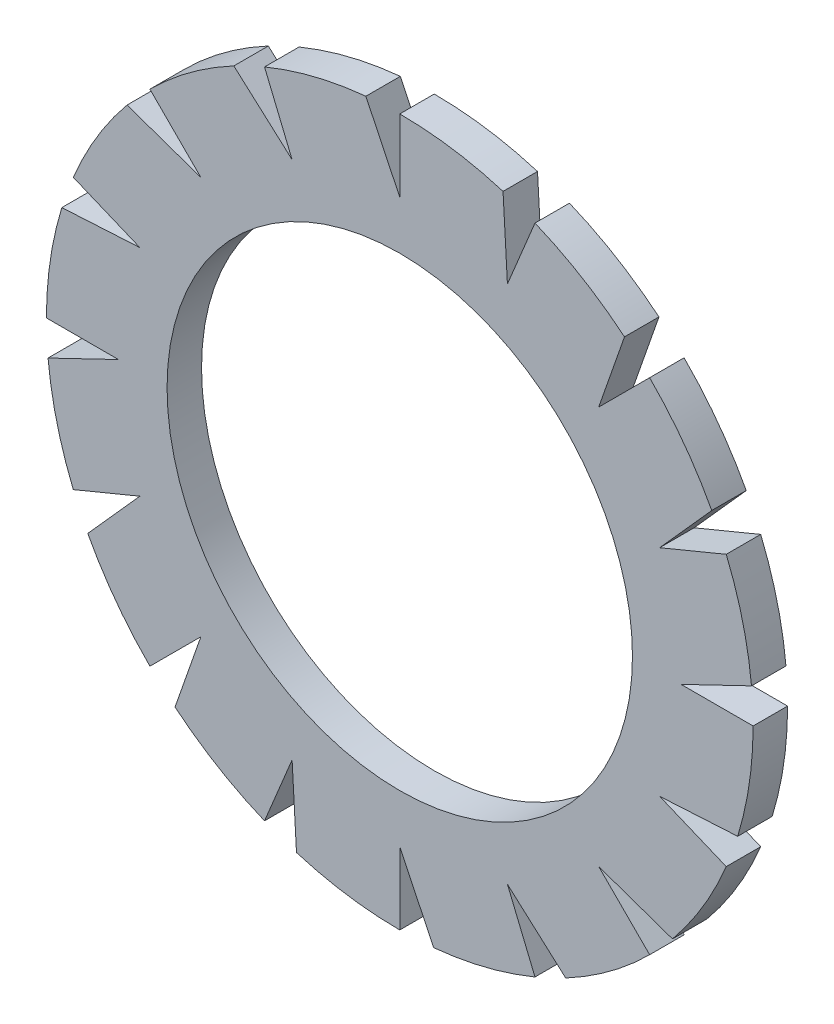
from build123d import *

# Parameters (mm, degrees)
BODYSKE_W      = 3.5
BODYSKE_H      = 1
TOOTHCUT_DEPTH = 15.530141087
TOOTHPAT_COUNT = 16


with BuildPart() as part:
    # BodySke → BaseBody (revolve)
    with BuildSketch(Plane(origin=(0, 0, 0), x_dir=(1, 0, 0), z_dir=(0, 1, 0))):
        with Locations((8.5, 0.5)):
            Rectangle(BODYSKE_W, BODYSKE_H)
    revolve(axis=Axis((0, 0, 0), (0, 0, -1)))

    # ToothSke → ToothCut (cut, through all)
    with BuildSketch(Plane.XY):
        Polygon((0, 8.16), (0, 10.25), (-1.006291397, 10.25), align=None)
    toothcut = extrude(amount=-TOOTHCUT_DEPTH, mode=Mode.SUBTRACT)

    # ToothPat: ToothCut ×16 about axis
    toothpat_axis = Axis((0, 0, 0), (0, 0, -1))
    for i in range(1, TOOTHPAT_COUNT):
        add(toothcut.rotate(toothpat_axis, i * 360 / TOOTHPAT_COUNT), mode=Mode.SUBTRACT)


solid = part.part
